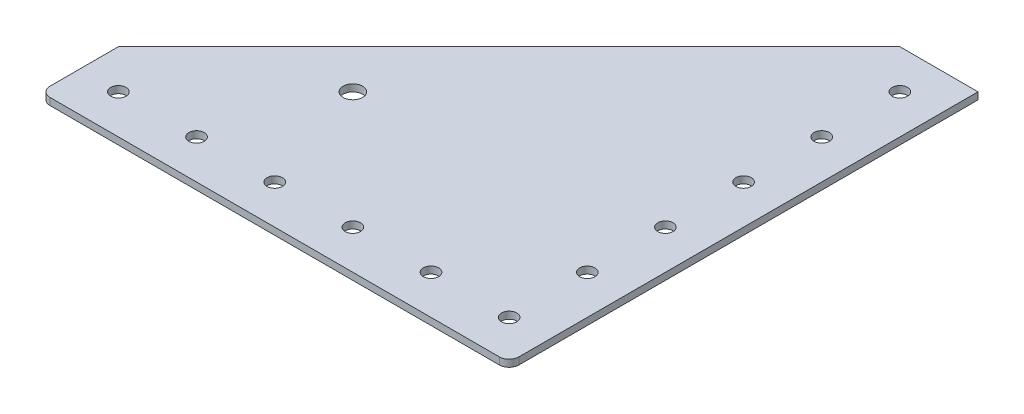
from build123d import *

# Parameters (mm, degrees)
SKETCH1_R           = 2.4892
SKETCH1_R_2         = 3.175
BOSS_EXTRUDE2_DEPTH = 1.143
FILLET1_R           = 3.175


with BuildPart() as part:
    # Sketch1 → Boss-Extrude2 (new, symmetric)
    with BuildSketch(Plane(origin=(0, 0, 0), x_dir=(1, 0, 0), z_dir=(0, 1, 0))):
        Polygon((0, 0), (0, 152.4), (-25.4, 152.4), (-152.4, 25.4), (-152.4, 0), align=None)
        with Locations((-12.7, 12.7)):
            Circle(SKETCH1_R, mode=Mode.SUBTRACT)
        with Locations((-38.1, 12.7)):
            Circle(SKETCH1_R, mode=Mode.SUBTRACT)
        with Locations((-63.5, 12.7)):
            Circle(SKETCH1_R, mode=Mode.SUBTRACT)
        with Locations((-88.9, 12.7)):
            Circle(SKETCH1_R, mode=Mode.SUBTRACT)
        with Locations((-114.3, 12.7)):
            Circle(SKETCH1_R, mode=Mode.SUBTRACT)
        with Locations((-12.7, 38.1)):
            Circle(SKETCH1_R, mode=Mode.SUBTRACT)
        with Locations((-12.7, 63.5)):
            Circle(SKETCH1_R, mode=Mode.SUBTRACT)
        with Locations((-12.7, 88.9)):
            Circle(SKETCH1_R, mode=Mode.SUBTRACT)
        with Locations((-12.7, 114.3)):
            Circle(SKETCH1_R, mode=Mode.SUBTRACT)
        with Locations((-139.7, 12.7)):
            Circle(SKETCH1_R, mode=Mode.SUBTRACT)
        with Locations((-12.7, 139.7)):
            Circle(SKETCH1_R, mode=Mode.SUBTRACT)
        with Locations((-101.6, 50.8)):
            Circle(SKETCH1_R_2, mode=Mode.SUBTRACT)
    extrude(amount=BOSS_EXTRUDE2_DEPTH, both=True)

    # Fillet1
    fillet1_edges = [part.edges().sort_by_distance(p)[0] for p in [
        (0, 0, 0),
        (-152.4, 0, 0),
    ]]
    fillet(fillet1_edges, radius=FILLET1_R)


solid = part.part
